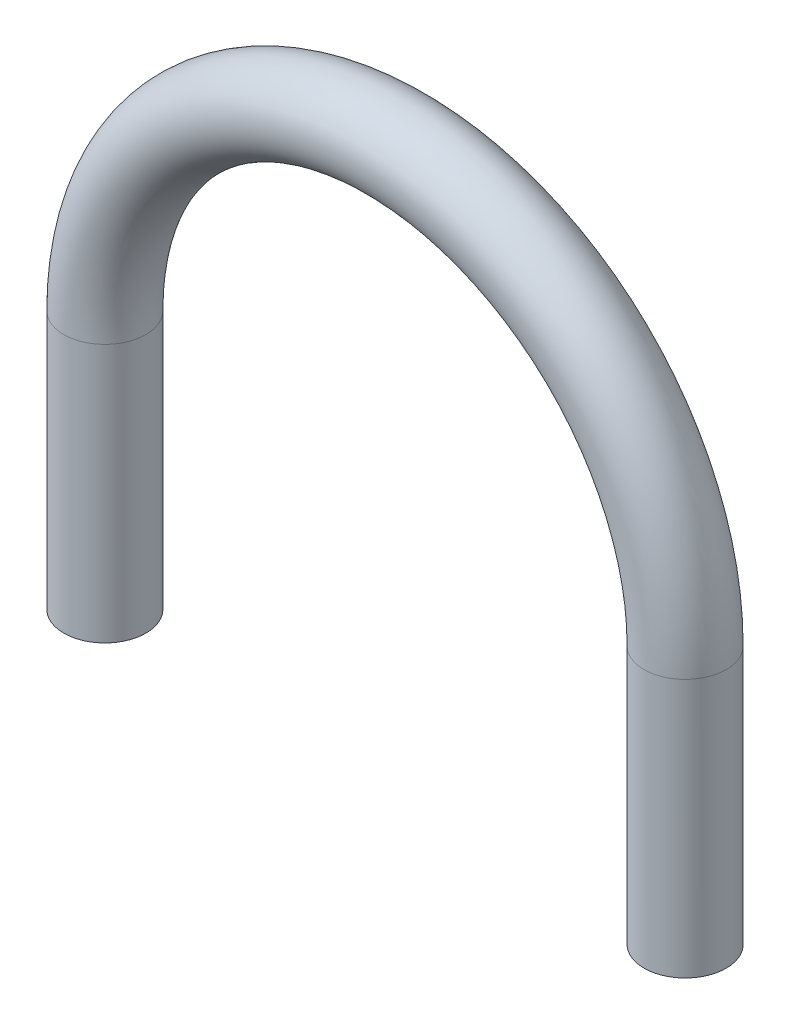
from build123d import *

# Parameters (mm, degrees)
BALAYAGE3_PROFILE_R = 3.175


with BuildPart() as part:
    # Balayage3: sweep along a path in Esquisse1
    with BuildLine(Plane.XY) as balayage3_path:
        Line((-22.44, -20), (-22.44, 0))
        ThreePointArc((-22.44, 0), (0, 22.44), (22.44, 0))
        Line((22.44, 0), (22.44, -20))
    # Balayage3 profile (on start of the path) → Balayage3 (sweep)
    with BuildSketch(Plane(origin=(-22.44, -20, 0), x_dir=(0, 0, 1), z_dir=(0, 1, 0))):
        Circle(BALAYAGE3_PROFILE_R)
    sweep(path=balayage3_path.line)


solid = part.part
